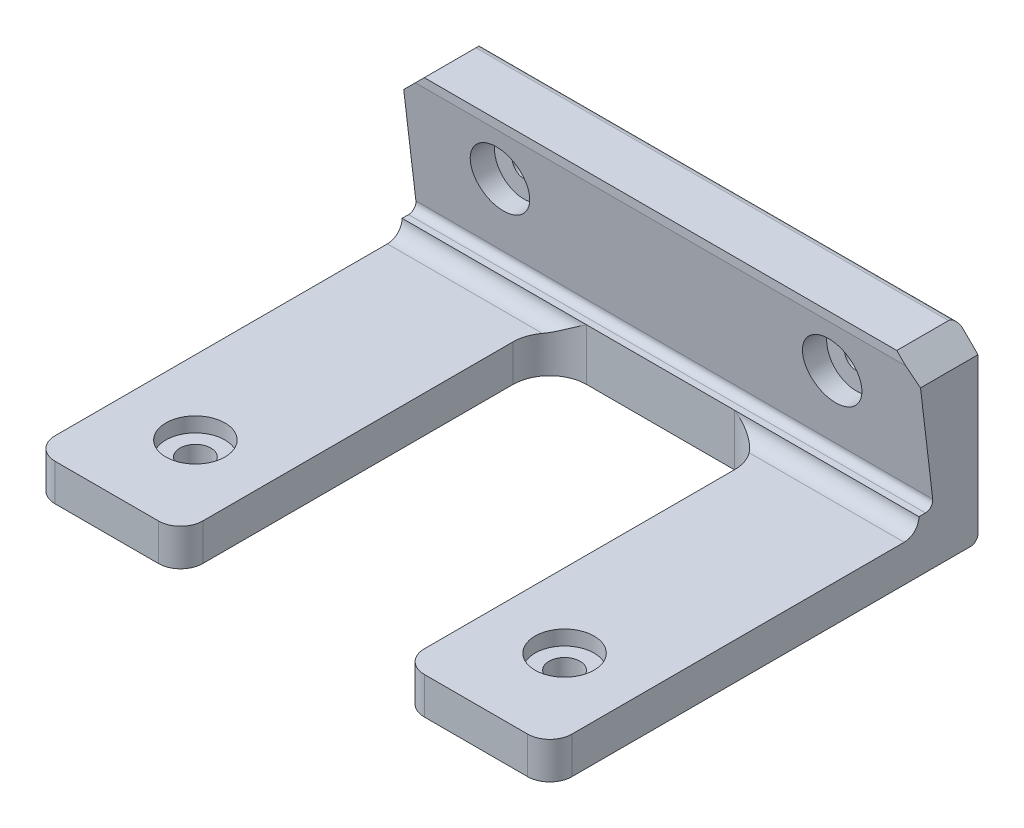
from build123d import *

# Parameters (mm, degrees)
SKETCH1_W           = 70
SKETCH1_H           = 25
BOSS_EXTRUDE1_DEPTH = 8
SKETCH4_W           = 20
SKETCH4_H           = 5
BOSS_EXTRUDE2_DEPTH = 50
CHAMFER1_SIZE       = 3
CUT_EXTRUDE5_DEPTH  = 92.761920207
FILLET13_R          = 5
FILLET14_R          = 2
FILLET15_R          = 1
SKETCH11_R          = 2.1
CUT_EXTRUDE6_DEPTH  = 10
FILLET18_R          = 3
FILLET20_R          = 1
SKETCH16_R          = 1.6
CUT_EXTRUDE11_DEPTH = 10
SKETCH17_R          = 4
CUT_EXTRUDE12_DEPTH = 4
SKETCH18_R          = 4
CUT_EXTRUDE13_DEPTH = 2


with BuildPart() as part:
    # Sketch1 → Boss-Extrude1 (new body)
    with BuildSketch(Plane.XY):
        Rectangle(SKETCH1_W, SKETCH1_H)
    extrude(amount=BOSS_EXTRUDE1_DEPTH)

    # Sketch4 → Boss-Extrude2 (add)
    with BuildSketch(Plane.XY.offset(8)):
        with Locations((-25, -10)):
            Rectangle(SKETCH4_W, SKETCH4_H)
    boss_extrude2 = extrude(amount=BOSS_EXTRUDE2_DEPTH)

    # Mirror1: Boss-Extrude2 across plane
    add(boss_extrude2.mirror(Plane.ZY))

    # Chamfer1
    chamfer1_edges = [part.edges().sort_by_distance(p)[0] for p in [
        (-35, 12.5, 4),
        (35, 12.5, 4),
    ]]
    chamfer(chamfer1_edges, length=CHAMFER1_SIZE)

    # Sketch10 → Cut-Extrude5 (cut, through all)
    with BuildSketch(Plane.ZY.offset(35)):
        Polygon((8, 11.3), (6, -5.5), (8, -5.5), align=None)
    extrude(amount=-CUT_EXTRUDE5_DEPTH, mode=Mode.SUBTRACT)

    # Fillet13
    fillet13_edges = [part.edges().sort_by_distance(p)[0] for p in [
        (-15, -10, 8),
        (15, -10, 8),
    ]]
    fillet(fillet13_edges, radius=FILLET13_R)

    # Fillet14
    fillet14_edges = [part.edges().sort_by_distance(p)[0] for p in [
        (22.5, -7.5, 8),
        (-22.5, -7.5, 8),
    ]]
    fillet(fillet14_edges, radius=FILLET14_R - 0.0001)  # a hair under: the kernel refuses the full size

    # Fillet15
    fillet15_edges = [part.edges().sort_by_distance(p)[0] for p in [
        (0, 12.5, 0),
        (0, -12.5, 0),
    ]]
    fillet(fillet15_edges, radius=FILLET15_R)

    # Sketch11 → Cut-Extrude6 (cut)
    with BuildSketch(Plane(origin=(0, -7.5, 0), x_dir=(1, 0, 0), z_dir=(0, 1, 0))):
        with Locations(Location((-25, -46, 0), (0, 0, 270))):
            Circle(SKETCH11_R)
        with Locations(Location((25, -46, 0), (0, 0, 270))):
            Circle(SKETCH11_R)
    extrude(amount=-CUT_EXTRUDE6_DEPTH, mode=Mode.SUBTRACT)

    # Fillet18
    fillet18_edges = [part.edges().sort_by_distance(p)[0] for p in [
        (-35, -10, 58),
        (-15, -10, 58),
        (35, -10, 58),
        (15, -10, 58),
    ]]
    fillet(fillet18_edges, radius=FILLET18_R)

    # Fillet20
    fillet20_edges = [part.edges().sort_by_distance(p)[0] for p in [
        (0, -5.5, 6),
    ]]
    fillet(fillet20_edges, radius=FILLET20_R)

    # Sketch16 → Cut-Extrude11 (cut)
    with BuildSketch(Plane(origin=(0, 0, 8), x_dir=(-1, 0, 0), z_dir=(0, 0, -1))):
        with Locations(Location((-22.5, 5, 0), (0, 0, 180))):
            Circle(SKETCH16_R)
        with Locations(Location((22.5, 5, 0), (0, 0, 180))):
            Circle(SKETCH16_R)
    extrude(amount=CUT_EXTRUDE11_DEPTH, mode=Mode.SUBTRACT)

    # Sketch17 → Cut-Extrude12 (cut)
    with BuildSketch(Plane(origin=(0, 0, 8), x_dir=(-1, 0, 0), z_dir=(0, 0, -1))):
        with Locations(Location((-22.5, 5, 0), (0, 0, 90))):
            Circle(SKETCH17_R)
        with Locations(Location((22.5, 5, 0), (0, 0, 90))):
            Circle(SKETCH17_R)
    extrude(amount=CUT_EXTRUDE12_DEPTH, mode=Mode.SUBTRACT)

    # Sketch18 → Cut-Extrude13 (cut)
    with BuildSketch(Plane(origin=(0, -7.5, 0), x_dir=(1, 0, 0), z_dir=(0, 1, 0))):
        with Locations(Location((-25, -46, 0), (0, 0, 270))):
            Circle(SKETCH18_R)
        with Locations(Location((25, -46, 0), (0, 0, 270))):
            Circle(SKETCH18_R)
    extrude(amount=-CUT_EXTRUDE13_DEPTH, mode=Mode.SUBTRACT)


solid = part.part
